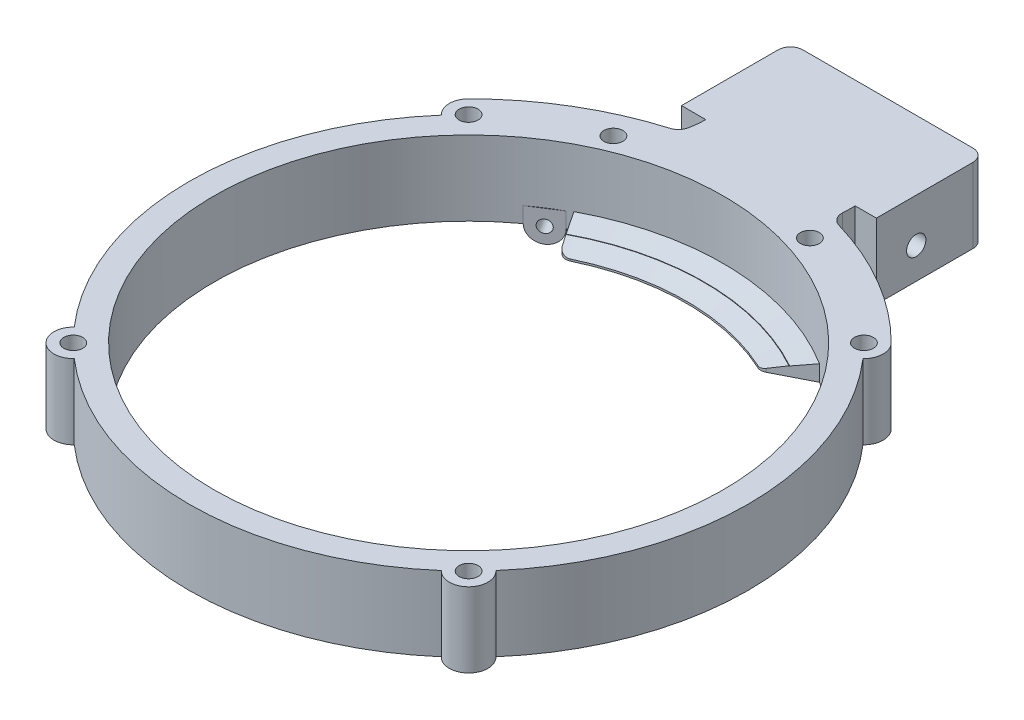
from build123d import *
from build123d.topology import SkipClean

# Parameters (mm, degrees)
SKETCH_1_R               = 40.9
SKETCH_1_R_2             = 1.525
EXTRUDE_1_DEPTH          = 1.5
EXTRUDE_START            = -1.5
EXTRUDE_2_DEPTH          = 1.5
CUT_EXTRUDE_1_DEPTH      = 70.399279535
CUT_EXTRUDE_1_DEPTH_BACK = 70.399279535
SKETCH_3_R               = 1.525
SKETCH_4_R               = 40.9
SKETCH_4_R_2             = 1.525
EXTRUDE_3_DEPTH          = 10.5
CUT_EXTRUDE_START        = -12
CUT_EXTRUDE_2_DEPTH      = 12
EXTRUDE_4_DEPTH          = 2.5
EXTRUDE_5_REACH          = 106.449
EXTRUDE_5_END_RADIUS     = 48
SKETCH_8_R               = 1
CUT_EXTRUDE_3_DEPTH      = 105.448711512
CHAMFER_1_SIZE           = 1.2
CHAMFER_1_SIZE_2         = 2.827022839
CHAMFER_2_SIZE           = 1.091910703
CHAMFER_2_SIZE_2         = 3
SKETCH_9_W               = 24
SKETCH_9_H               = 12
EXTRUDE_6_DEPTH          = 17.5
SKETCH_10_R              = 1.55
CUT_EXTRUDE_4_DEPTH      = 90.170454762
SKETCH_11_W              = 17.5
SKETCH_11_H              = 12
SKETCH_11_R              = 1.55
EXTRUDE_7_DEPTH          = 3.9
EXTRUDE_START_2          = 3.4
SKETCH_12_W              = 17.5
SKETCH_12_H              = 12
SKETCH_12_R              = 1.55
EXTRUDE_8_DEPTH          = 3.4
FILLET_1_R               = 2


with BuildPart() as part:
    # 草图1 → 凸台-拉伸1 (new body)
    with BuildSketch(Plane(origin=(0, 0, 0), x_dir=(1, 0, 0), z_dir=(0, 1, 0))):
        with BuildLine():
            Line((12, 50.1), (-12, 50.1))
            ThreePointArc((-12, 50.1), (-12.071709603, 48.790080839), (-12.285981368, 47.495817309))
            ThreePointArc((-12.285981368, 47.495817309), (-12.775478285, 46.565992731), (-13.668785094, 46.012653847))
            ThreePointArc((-13.668785094, 46.012653847), (0.147817484, -47.999772395), (13.385132402, 46.095967617))
            ThreePointArc((13.385132402, 46.095967617), (12.311228539, 46.859989672), (11.945854344, 48.126283833))
            ThreePointArc((11.945854344, 48.126283833), (11.98646104, 49.112770637), (12, 50.1))
        make_face()
        with Locations(Location((0, 0, 0), (0, 0, 270))):
            Circle(SKETCH_1_R, mode=Mode.SUBTRACT)
        with Locations(Location((12.835117837, 41.981778787, 0), (0, 0, 270))):
            Circle(SKETCH_1_R_2, mode=Mode.SUBTRACT)
        with Locations(Location((-17.153096541, 40.410163067, 0), (0, 0, 270))):
            Circle(SKETCH_1_R_2, mode=Mode.SUBTRACT)
    extrude(amount=EXTRUDE_1_DEPTH)

    # 草图2 → 凸台-拉伸2 (add)
    with BuildSketch(Plane(origin=(0, 1.5, 0), x_dir=(1, 0, 0), z_dir=(0, 1, 0)).offset(EXTRUDE_START)):
        with BuildLine():
            Line((-19.201386918, 36.112556548), (-17.121235913, 32.200361501))
            ThreePointArc((-17.121235913, 32.200361501), (-16.264760822, 31.479428059), (-15.147630365, 31.55232629))
            ThreePointArc((-15.147630365, 31.55232629), (-0.252986109, 34.999085674), (14.689928016, 31.768003004))
            ThreePointArc((14.689928016, 31.768003004), (15.348239226, 31.629764257), (16.000770136, 31.793125857))
            Line((16.000770136, 31.793125857), (21.673697907, 34.685167133))
            ThreePointArc((21.673697907, 34.685167133), (1.427389415, 40.875084825), (-19.201386918, 36.112556548))
        make_face()
    extrude(amount=EXTRUDE_2_DEPTH)

    # 草图3 → 切除-拉伸1 (cut, two sides: drawn at the far end of the back side and taken through both)
    with BuildSketch(Plane(origin=(0, 1.5, 0), x_dir=(1, 0, 0), z_dir=(0, 1, 0)).offset(-CUT_EXTRUDE_1_DEPTH_BACK)):
        with Locations(Location((31.749094475, 31.749094475, 0), (0, 0, 270))):
            Circle(SKETCH_3_R)
        with Locations(Location((31.749094475, -31.749094475, 0), (0, 0, 270))):
            Circle(SKETCH_3_R)
        with Locations(Location((-31.749094475, -31.749094475, 0), (0, 0, 270))):
            Circle(SKETCH_3_R)
        with Locations(Location((-31.749094475, 31.749094475, 0), (0, 0, 270))):
            Circle(SKETCH_3_R)
    extrude(amount=CUT_EXTRUDE_1_DEPTH + CUT_EXTRUDE_1_DEPTH_BACK, mode=Mode.SUBTRACT)

    # 草图4 → 凸台-拉伸3 (add)
    with SkipClean():  # the faces are left unmerged after this step: merging them gives an invalid solid
        with BuildSketch(Plane(origin=(0, 1.5, 0), x_dir=(1, 0, 0), z_dir=(0, 1, 0))):
            with BuildLine():
                Line((12, 50.1), (-12, 50.1))
                ThreePointArc((-12, 50.1), (-12.071709603, 48.790080839), (-12.285981368, 47.495817309))
                ThreePointArc((-12.285981368, 47.495817309), (-12.775478285, 46.565992731), (-13.668785094, 46.012653847))
                ThreePointArc((-13.668785094, 46.012653847), (0.147817484, -47.999772395), (13.385132402, 46.095967617))
                ThreePointArc((13.385132402, 46.095967617), (12.311228539, 46.859989672), (11.945854344, 48.126283833))
                ThreePointArc((11.945854344, 48.126283833), (11.98646104, 49.112770637), (12, 50.1))
            make_face()
            with Locations(Location((0, 0, 0), (0, 0, 118))):
                Circle(SKETCH_4_R, mode=Mode.SUBTRACT)
            with Locations(Location((-17.153096541, 40.410163067, 0), (0, 0, 270))):
                Circle(SKETCH_4_R_2, mode=Mode.SUBTRACT)
            with Locations(Location((12.835117837, 41.981778787, 0), (0, 0, 270))):
                Circle(SKETCH_4_R_2, mode=Mode.SUBTRACT)
            with Locations(Location((31.749094475, 31.749094475, 0), (0, 0, 270))):
                Circle(SKETCH_4_R_2, mode=Mode.SUBTRACT)
            with Locations(Location((31.749094475, -31.749094475, 0), (0, 0, 270))):
                Circle(SKETCH_4_R_2, mode=Mode.SUBTRACT)
            with Locations(Location((-31.749094475, -31.749094475, 0), (0, 0, 270))):
                Circle(SKETCH_4_R_2, mode=Mode.SUBTRACT)
            with Locations(Location((-31.749094475, 31.749094475, 0), (0, 0, 270))):
                Circle(SKETCH_4_R_2, mode=Mode.SUBTRACT)
        extrude(amount=EXTRUDE_3_DEPTH)
    add(part.part.scale(1), mode=Mode.REPLACE)  # the faces are merged on a copy

    # 草图5 → 切除-拉伸2 (cut)
    with BuildSketch(Plane(origin=(0, 12, 0), x_dir=(1, 0, 0), z_dir=(0, 1, 0)).offset(CUT_EXTRUDE_START)):
        with BuildLine():
            ThreePointArc((-33.864147525, 29.482698526), (-34.848632515, 31.695578705), (-33.941125497, 33.941125497))
            ThreePointArc((-33.941125497, 33.941125497), (-48, 0), (-33.941125497, -33.941125497))
            ThreePointArc((-33.941125497, -33.941125497), (-34.848632515, -31.695578705), (-33.864147525, -29.482698526))
            ThreePointArc((-33.864147525, -29.482698526), (-44.9, 0), (-33.864147525, 29.482698526))
        make_face()
        with BuildLine():
            ThreePointArc((33.864147525, -29.482698526), (34.848632515, -31.695578705), (33.941125497, -33.941125497))
            ThreePointArc((33.941125497, -33.941125497), (48, 0), (33.941125497, 33.941125497))
            ThreePointArc((33.941125497, 33.941125497), (34.848632515, 31.695578705), (33.864147525, 29.482698526))
            ThreePointArc((33.864147525, 29.482698526), (44.9, 0), (33.864147525, -29.482698526))
        make_face()
        with BuildLine():
            ThreePointArc((-29.482698526, -33.864147525), (-31.695578705, -34.848632515), (-33.941125497, -33.941125497))
            ThreePointArc((-33.941125497, -33.941125497), (0, -48), (33.941125497, -33.941125497))
            ThreePointArc((33.941125497, -33.941125497), (31.695578705, -34.848632515), (29.482698526, -33.864147525))
            ThreePointArc((29.482698526, -33.864147525), (0, -44.9), (-29.482698526, -33.864147525))
        make_face()
    extrude(amount=CUT_EXTRUDE_2_DEPTH, mode=Mode.SUBTRACT)

    # 草图6 → 凸台-拉伸4 (add)
    with BuildSketch(Plane.XZ):
        with BuildLine():
            Line((-20, -35.676462829), (-24.203821377, -32.969456027))
            ThreePointArc((-24.203821377, -32.969456027), (-22.14331564, -34.387258868), (-20, -35.676462829))
        make_face()
    extrude(amount=-EXTRUDE_4_DEPTH)

    # 凸台-拉伸5: up to this cylinder (the profile starts inside it)
    extrude_5_end = Plane(origin=(0, -1.061033, 0), z_dir=(0, -1, 0)) * Cylinder(EXTRUDE_5_END_RADIUS, 309.898, mode=Mode.PRIVATE)
    # 草图7 → 凸台-拉伸5 (add, up to the surface)
    with BuildSketch(Plane(origin=(-22.101910689, 0, -34.322959428), x_dir=(0.8407642754995167, 0, -0.5414013604007409), z_dir=(0.5414013604007408, 0, 0.8407642754995166)), mode=Mode.PRIVATE) as extrude_5_sk1:
        with BuildLine():
            Line((-2.5, 0), (2.5, 0))
            ThreePointArc((2.5, 0), (0, -2.5), (-2.5, 0))
        make_face()
    extrude_5_tool1 = extrude(extrude_5_sk1.sketch, amount=-EXTRUDE_5_REACH, mode=Mode.PRIVATE) & extrude_5_end
    add(extrude_5_tool1.solids().sort_by_distance((-22.101911, -1.061033, -34.322959))[0])

    # 草图8 → 切除-拉伸3 (cut, through all)
    with BuildSketch(Plane(origin=(-22.101910689, 0, -34.322959428), x_dir=(0.8407642754995167, 0, -0.5414013604007409), z_dir=(0.5414013604007408, 0, 0.8407642754995166))):
        Circle(SKETCH_8_R)
    extrude(amount=-CUT_EXTRUDE_3_DEPTH, mode=Mode.SUBTRACT)

    # 倒角1
    # the kernel refuses this chamfer: 2.827022839, 1.2 mm, written as the material it takes off along each edge
    with BuildSketch(Plane(origin=(0, 1.5, 0), x_dir=(-0.6107443245214345, 0, -0.7918278664361699), z_dir=(-0.7918278664361699, 0, 0.6107443245214345))) as chamfer_1_piece_1:
        Polygon((35, CHAMFER_1_SIZE), (35 + CHAMFER_1_SIZE_2, 0), (35, 0), align=None)
    revolve(axis=Axis((0, 1.5, 0), (0, -1, 0)), revolution_arc=74.458388902, mode=Mode.SUBTRACT)

    # 倒角2
    # the kernel refuses this chamfer: 3, 1.091910703 mm, written as the material it adds along each edge
    with BuildSketch(Plane(origin=(0, 1.5, 0), x_dir=(0.6807767680816117, 0, -0.7324909501422905), z_dir=(0.7324909501422905, 0, 0.6807767680816117))) as chamfer_2_piece_1_section:
        Polygon((40.9, CHAMFER_2_SIZE), (40.9 - CHAMFER_2_SIZE_2, 0), (40.9, 0), align=None)
    chamfer_2_piece_1 = revolve(axis=Axis((0, 1.5, 0), (0, 1, 0)), revolution_arc=70.9043723, mode=Mode.PRIVATE)
    chamfer_2_piece_1 = split(chamfer_2_piece_1, bisect_by=Plane(origin=(7.492047447, 2.005552707, -27.455404982), z_dir=(-0.45418251766199275, 0, -0.8909086601050715)), keep=Keep.TOP, mode=Mode.PRIVATE)
    add(chamfer_2_piece_1)

    # 草图9 → 凸台-拉伸6 (add)
    with BuildSketch(Plane(origin=(0, 0, -50.1), x_dir=(-1, 0, 0), z_dir=(0, 0, -1))):
        with Locations((0, 6)):
            Rectangle(SKETCH_9_W, SKETCH_9_H)
    extrude(amount=EXTRUDE_6_DEPTH)

    # 草图10 → 切除-拉伸4 (cut, through all)
    with BuildSketch(Plane(origin=(12, 0, 0), x_dir=(0, 0, -1), z_dir=(1, 0, 0))):
        with Locations((56.5, 5)):
            Circle(SKETCH_10_R)
    extrude(amount=-CUT_EXTRUDE_4_DEPTH, mode=Mode.SUBTRACT)

    # 草图11 → 凸台-拉伸7 (add)
    with SkipClean():  # the faces are left unmerged after this step: merging them gives an invalid solid
        with BuildSketch(Plane.ZY.offset(12)):
            with Locations((-58.85, 6)):
                Rectangle(SKETCH_11_W, SKETCH_11_H)
            with Locations(Location((-56.5, 5, 0), (0, 0, 180))):
                Circle(SKETCH_11_R, mode=Mode.SUBTRACT)
        extrude(amount=EXTRUDE_7_DEPTH)

    # 草图12 → 凸台-拉伸8 (add)
    with SkipClean():  # the faces are left unmerged after this step: merging them gives an invalid solid
        with BuildSketch(Plane(origin=(12, 0, 0), x_dir=(0, 0, -1), z_dir=(1, 0, 0)).offset(EXTRUDE_START_2)):
            with Locations((58.85, 6)):
                Rectangle(SKETCH_12_W, SKETCH_12_H)
            with Locations((56.5, 5)):
                Circle(SKETCH_12_R, mode=Mode.SUBTRACT)
        extrude(amount=-EXTRUDE_8_DEPTH)

    # 圆角1
    fillet_1_edges = [part.edges().sort_by_distance(p)[0] for p in [
        (-15.9, 6, -67.6),
        (15.4, 6, -67.6),
    ]]
    fillet(fillet_1_edges, radius=FILLET_1_R)


solid = part.part
